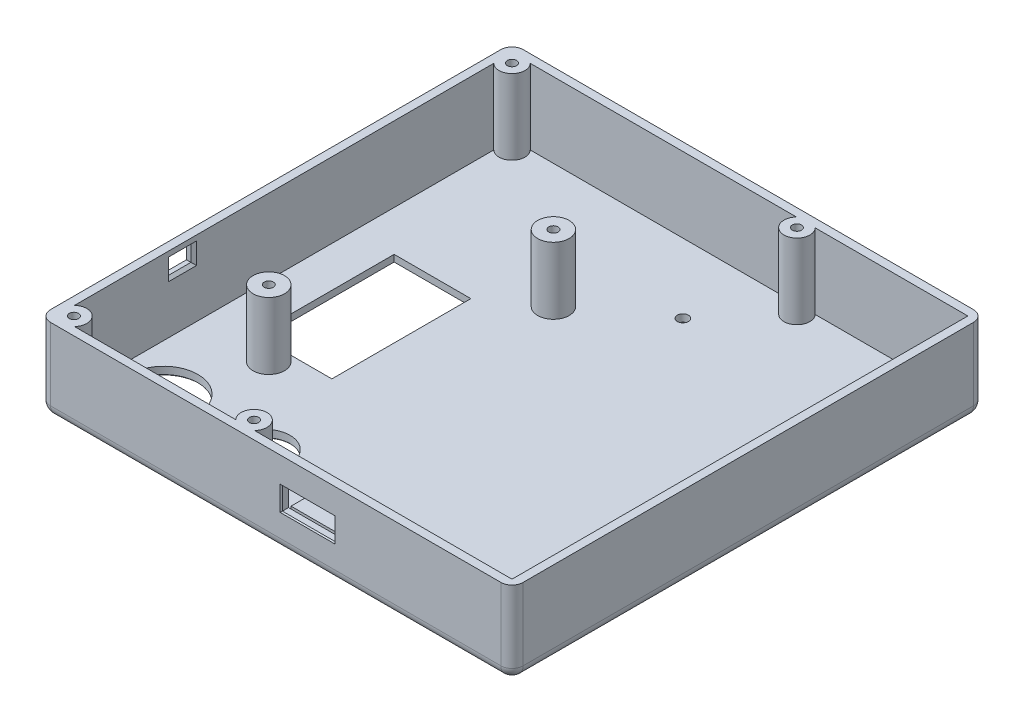
from build123d import *

# Parameters (mm, degrees)
SKETCH_1_W            = 85
SKETCH_1_H            = 85
EXTRUDE_1_DEPTH       = 15
SHELL_1_T             = -1.5
FILLET_1_R            = 2
FILLET_2_R            = 2
CUT_EXTRUDE_7_REACH   = 98.209
SKETCH_16_W           = 9.5
SKETCH_16_H           = 4
CUT_EXTRUDE_2_REACH   = 63.948
SKETCH_3_R            = 1.9
CUT_EXTRUDE_3_REACH   = 63.948
SKETCH_4_R            = 6.15
CHAMFER_1_SIZE        = 0.2
CUT_EXTRUDE_4_REACH   = 98.209
SKETCH_5_W            = 4
SKETCH_5_H            = 2.84
CHAMFER_3_SIZE        = 0.2
CHAMFER_4_SIZE        = 0.5
CUT_EXTRUDE_6_REACH   = 63.948
SKETCH_6_W            = 13.8
SKETCH_6_H            = 25
CHAMFER_6_SIZE        = 0.3
CUT_EXTRUDE_7_2_REACH = 63.948
SKETCH_7_R            = 4.45
CUT_EXTRUDE_8_REACH   = 63.948
SKETCH_9_R            = 1
CHAMFER_7_SIZE        = 0.2
SKETCH_10_R           = 2.325
SKETCH_10_R_2         = 0.825
EXTRUDE_1_2_DEPTH     = 13.5
SKETCH_12_R           = 2.825
SKETCH_12_R_2         = 0.825
EXTRUDE_2_DEPTH       = 12
EXTRUDE_START         = -1.5
SKETCH_14_W           = 5
SKETCH_14_H           = 5
EXTRUDE_3_DEPTH       = 3.9
SKETCH_15_W           = 9
SKETCH_15_H           = 4
EXTRUDE_4_DEPTH       = 5
CUT_EXTRUDE_1_DEPTH   = 0.2


with BuildPart() as part:
    # 草图1 → Extrude 1 (new body)
    with BuildSketch(Plane(origin=(0, 0, 0), x_dir=(1, 0, 0), z_dir=(0, 1, 0))):
        Rectangle(SKETCH_1_W, SKETCH_1_H)
    extrude(amount=EXTRUDE_1_DEPTH)

    # 抽壳1
    shell_1_openings = [part.faces().sort_by_distance(p)[0] for p in [
        (0, 15, 0),
    ]]
    offset(amount=SHELL_1_T, openings=shell_1_openings, kind=Kind.INTERSECTION)

    # 圆角1
    fillet_1_edges = [part.edges().sort_by_distance(p)[0] for p in [
        (0, 0, 42.5),
        (-42.5, 0, 0),
        (0, 0, -42.5),
        (42.5, 0, 0),
    ]]
    fillet(fillet_1_edges, radius=FILLET_1_R)

    # 圆角2
    # the kernel refuses this fillet: 2 mm, written as the material it takes off along each edge
    with BuildSketch(Plane(origin=(-40.5, 2, -40.5), x_dir=(-1, 0, 0), z_dir=(0, 0, -1))) as fillet_2_piece_1_section:
        Polygon((0, 0), (FILLET_2_R, 0), (FILLET_2_R, -FILLET_2_R), (0, -FILLET_2_R), align=None)
    fillet_2_piece_1 = extrude(amount=FILLET_2_R, mode=Mode.PRIVATE)
    fillet_2_piece_1 = fillet_2_piece_1 - Plane(origin=(-40.5, 2, -40.5), x_dir=(0.7071067811865475, 0.7071067811865475, 0), z_dir=(0, 0, -1)) * Sphere(FILLET_2_R, mode=Mode.PRIVATE)
    add(fillet_2_piece_1, mode=Mode.SUBTRACT)
    with BuildSketch(Plane(origin=(40.5, 2, -40.5), x_dir=(1, 0, 0), z_dir=(0, 0, -1))) as fillet_2_piece_2_section:
        Polygon((0, 0), (FILLET_2_R, 0), (FILLET_2_R, FILLET_2_R), (0, FILLET_2_R), align=None)
    fillet_2_piece_2 = extrude(amount=FILLET_2_R, mode=Mode.PRIVATE)
    fillet_2_piece_2 = fillet_2_piece_2 - Plane(origin=(40.5, 2, -40.5), x_dir=(-0.7071067811865475, 0.7071067811865475, 0), z_dir=(0, 0, -1)) * Sphere(FILLET_2_R, mode=Mode.PRIVATE)
    add(fillet_2_piece_2, mode=Mode.SUBTRACT)
    with BuildSketch(Plane(origin=(-40.5, 2, 40.5), x_dir=(0, 0, 1), z_dir=(-1, 0, 0))) as fillet_2_piece_3_section:
        Polygon((0, 0), (FILLET_2_R, 0), (FILLET_2_R, -FILLET_2_R), (0, -FILLET_2_R), align=None)
    fillet_2_piece_3 = extrude(amount=FILLET_2_R, mode=Mode.PRIVATE)
    fillet_2_piece_3 = fillet_2_piece_3 - Plane(origin=(-40.5, 2, 40.5), x_dir=(0, 0.7071067811865475, -0.7071067811865475), z_dir=(-1, 0, 0)) * Sphere(FILLET_2_R, mode=Mode.PRIVATE)
    add(fillet_2_piece_3, mode=Mode.SUBTRACT)
    with BuildSketch(Plane(origin=(40.5, 2, 40.5), x_dir=(0, 0, 1), z_dir=(1, 0, 0))) as fillet_2_piece_4_section:
        Polygon((0, 0), (FILLET_2_R, 0), (FILLET_2_R, FILLET_2_R), (0, FILLET_2_R), align=None)
    fillet_2_piece_4 = extrude(amount=FILLET_2_R, mode=Mode.PRIVATE)
    fillet_2_piece_4 = fillet_2_piece_4 - Plane(origin=(40.5, 2, 40.5), x_dir=(0, 0.7071067811865475, -0.7071067811865475), z_dir=(1, 0, 0)) * Sphere(FILLET_2_R, mode=Mode.PRIVATE)
    add(fillet_2_piece_4, mode=Mode.SUBTRACT)
    with BuildSketch(Plane(origin=(42.5, 2, 42.5), x_dir=(0, 0, -1), z_dir=(0, 1, 0)), Plane(origin=(42.5, 2, -42.5), x_dir=(-1, 0, 0), z_dir=(0, 1, 0))) as fillet_2_piece_5:
        with BuildLine():
            CenterArc((FILLET_2_R, FILLET_2_R), FILLET_2_R, 180, 90)
            Line((0, FILLET_2_R), (0, 0))
            Line((0, 0), (FILLET_2_R, 0))
        make_face()
    extrude(amount=18, mode=Mode.SUBTRACT)
    with BuildSketch(Plane(origin=(-42.5, 2, 42.5), x_dir=(0, 0, -1), z_dir=(0, 1, 0)), Plane(origin=(-42.5, 2, -42.5), x_dir=(1, 0, 0), z_dir=(0, 1, 0))) as fillet_2_piece_6:
        with BuildLine():
            CenterArc((FILLET_2_R, -FILLET_2_R), FILLET_2_R, 90, 90)
            Line((0, -FILLET_2_R), (0, 0))
            Line((0, 0), (FILLET_2_R, 0))
        make_face()
    extrude(amount=18, mode=Mode.SUBTRACT)

    # 草图16 → Cut-Extrude 7 (cut, up to next)
    with BuildSketch(Plane.XY.offset(42.5), mode=Mode.PRIVATE) as cut_extrude_7_sk1:
        with Locations((5.75, 8.25)):
            Rectangle(SKETCH_16_W, SKETCH_16_H)
    cut_extrude_7_tool1 = extrude(cut_extrude_7_sk1.sketch, amount=-CUT_EXTRUDE_7_REACH, mode=Mode.PRIVATE) & part.part
    add(cut_extrude_7_tool1.solids().sort_by_distance((5.75, 8.25, 42.5))[0], mode=Mode.SUBTRACT)

    # 草图3 → 充电灯切除-拉伸2 (cut, up to next)
    with BuildSketch(Plane.XZ, mode=Mode.PRIVATE) as cut_extrude_2_sk1:
        with Locations(Location((13.002314109, 32.5, 0), (0, 0, 270))):
            Circle(SKETCH_3_R)
    cut_extrude_2_tool1 = extrude(cut_extrude_2_sk1.sketch, amount=-CUT_EXTRUDE_2_REACH, mode=Mode.PRIVATE) & part.part
    add(cut_extrude_2_tool1.solids().sort_by_distance((13.002314, 0, 32.5))[0], mode=Mode.SUBTRACT)

    # 草图4 → 按钮切除-拉伸3 (cut, up to next)
    with BuildSketch(Plane.XZ, mode=Mode.PRIVATE) as cut_extrude_3_sk1:
        with Locations(Location((-32.65, 30, 0), (0, 0, 270))):
            Circle(SKETCH_4_R)
    cut_extrude_3_tool1 = extrude(cut_extrude_3_sk1.sketch, amount=-CUT_EXTRUDE_3_REACH, mode=Mode.PRIVATE) & part.part
    add(cut_extrude_3_tool1.solids().sort_by_distance((-32.65, 0, 30))[0], mode=Mode.SUBTRACT)

    # 充电口灯倒角1
    chamfer_1_edges = [part.edges().sort_by_distance(p)[0] for p in [
        (1, 8.25, 42.5),
        (5.75, 6.25, 42.5),
        (10.5, 8.25, 42.5),
        (5.75, 10.25, 42.5),
        (5.75, 6.25, 41),
        (10.5, 8.25, 41),
        (5.75, 10.25, 41),
        (1, 8.25, 41),
        (13.002314109, 1.5, 34.4),
    ]]
    chamfer(chamfer_1_edges, length=CHAMFER_1_SIZE)

    # 草图5 → 开关切除-拉伸4 (cut, up to next)
    with BuildSketch(Plane.ZY.offset(42.5), mode=Mode.PRIVATE) as cut_extrude_4_sk1:
        with Locations((18.25, 12.15)):
            Rectangle(SKETCH_5_W, SKETCH_5_H)
    cut_extrude_4_tool1 = extrude(cut_extrude_4_sk1.sketch, amount=-CUT_EXTRUDE_4_REACH, mode=Mode.PRIVATE) & part.part
    add(cut_extrude_4_tool1.solids().sort_by_distance((-42.5, 12.15, 18.25))[0], mode=Mode.SUBTRACT)

    # 开关倒角3
    chamfer_3_edges = [part.edges().sort_by_distance(p)[0] for p in [
        (-42.5, 12.15, 16.25),
        (-42.5, 10.73, 18.25),
        (-42.5, 12.15, 20.25),
        (-42.5, 13.57, 18.25),
    ]]
    chamfer(chamfer_3_edges, length=CHAMFER_3_SIZE)

    # 开关倒角4
    chamfer_4_edges = [part.edges().sort_by_distance(p)[0] for p in [
        (-41, 10.73, 18.25),
        (-41, 12.15, 20.25),
        (-41, 13.57, 18.25),
        (-41, 12.15, 16.25),
    ]]
    chamfer(chamfer_4_edges, length=CHAMFER_4_SIZE)

    # 草图6 → 屏幕切除-拉伸6 (cut, up to next)
    with BuildSketch(Plane.XZ, mode=Mode.PRIVATE) as cut_extrude_6_sk1:
        with Locations((-26.8, 0)):
            Rectangle(SKETCH_6_W, SKETCH_6_H)
    cut_extrude_6_tool1 = extrude(cut_extrude_6_sk1.sketch, amount=-CUT_EXTRUDE_6_REACH, mode=Mode.PRIVATE) & part.part
    add(cut_extrude_6_tool1.solids().sort_by_distance((-26.8, 0, 0))[0], mode=Mode.SUBTRACT)

    # 屏幕倒角6
    chamfer_6_edges = [part.edges().sort_by_distance(p)[0] for p in [
        (-19.9, 0, 0),
        (-26.8, 0, 12.5),
        (-33.7, 0, 0),
        (-26.8, 0, -12.5),
    ]]
    chamfer(chamfer_6_edges, length=CHAMFER_6_SIZE)

    # 草图7 → Cut-Extrude 7 2 (cut, up to next)
    with BuildSketch(Plane.XZ, mode=Mode.PRIVATE) as cut_extrude_7_2_sk1:
        with Locations(Location((-14.877357519, 29.5, 0), (0, 0, 270))):
            Circle(SKETCH_7_R)
    cut_extrude_7_2_tool1 = extrude(cut_extrude_7_2_sk1.sketch, amount=-CUT_EXTRUDE_7_2_REACH, mode=Mode.PRIVATE) & part.part
    add(cut_extrude_7_2_tool1.solids().sort_by_distance((-14.877358, 0, 29.5))[0], mode=Mode.SUBTRACT)

    # 草图9 → 蜂鸣切除-拉伸8 (cut, up to next)
    with BuildSketch(Plane.XZ, mode=Mode.PRIVATE) as cut_extrude_8_sk1:
        with Locations(Location((2.238237088, -28.5, 0), (0, 0, 270))):
            Circle(SKETCH_9_R)
    cut_extrude_8_tool1 = extrude(cut_extrude_8_sk1.sketch, amount=-CUT_EXTRUDE_8_REACH, mode=Mode.PRIVATE) & part.part
    add(cut_extrude_8_tool1.solids().sort_by_distance((2.238237, 0, -28.5))[0], mode=Mode.SUBTRACT)

    # 蜂鸣倒角7
    chamfer_7_edges = [part.edges().sort_by_distance(p)[0] for p in [
        (-14.877357519, 0, 33.95),
        (2.238237088, 0, -27.5),
        (-32.65, 0, 36.15),
    ]]
    chamfer(chamfer_7_edges, length=CHAMFER_7_SIZE)

    # 草图10 → Extrude 1 2 (add)
    # profile 1 of 4: a face of its own
    with BuildSketch(Plane(origin=(0, 1.5, 0), x_dir=(1, 0, 0), z_dir=(0, 1, 0))):
        with Locations((-39.4, 39.4)):
            Circle(SKETCH_10_R)
        with Locations((-39.4, 39.4)):
            Circle(SKETCH_10_R_2, mode=Mode.SUBTRACT)
    # profile 2 of 4: a face of its own
    with BuildSketch(Plane(origin=(0, 1.5, 0), x_dir=(1, 0, 0), z_dir=(0, 1, 0))):
        with Locations((-39.4, -39.4)):
            Circle(SKETCH_10_R)
        with Locations((-39.4, -39.4)):
            Circle(SKETCH_10_R_2, mode=Mode.SUBTRACT)
    # profile 3 of 4: a face of its own
    with BuildSketch(Plane(origin=(0, 1.5, 0), x_dir=(1, 0, 0), z_dir=(0, 1, 0))):
        with Locations((-7, -39.4)):
            Circle(SKETCH_10_R)
        with Locations((-7, -39.4)):
            Circle(SKETCH_10_R_2, mode=Mode.SUBTRACT)
    # profile 4 of 4: a face of its own
    with BuildSketch(Plane(origin=(0, 1.5, 0), x_dir=(1, 0, 0), z_dir=(0, 1, 0))):
        with Locations((11.85, 39.4)):
            Circle(SKETCH_10_R)
        with Locations((11.85, 39.4)):
            Circle(SKETCH_10_R_2, mode=Mode.SUBTRACT)
    extrude(amount=EXTRUDE_1_2_DEPTH)

    # 草图12 → 压板固定凸台-拉伸2 (add)
    # profile 1 of 2: a face of its own
    with BuildSketch(Plane(origin=(0, 1.5, 0), x_dir=(1, 0, 0), z_dir=(0, 1, 0))):
        with Locations(Location((-28.25, -15.5, 0), (0, 0, 90))):
            Circle(SKETCH_12_R)
        with Locations(Location((-28.25, -15.5, 0), (0, 0, 90))):
            Circle(SKETCH_12_R_2, mode=Mode.SUBTRACT)
    # profile 2 of 2: a face of its own
    with BuildSketch(Plane(origin=(0, 1.5, 0), x_dir=(1, 0, 0), z_dir=(0, 1, 0))):
        with Locations(Location((-11.25, 18.7, 0), (0, 0, 90))):
            Circle(SKETCH_12_R)
        with Locations(Location((-11.25, 18.7, 0), (0, 0, 90))):
            Circle(SKETCH_12_R_2, mode=Mode.SUBTRACT)
    extrude(amount=EXTRUDE_2_DEPTH)

    # 草图14 → 电池顶凸台-拉伸3 (add)
    with BuildSketch(Plane(origin=(42.5, 0, 0), x_dir=(0, 0, -1), z_dir=(1, 0, 0)).offset(EXTRUDE_START)):
        with Locations((12.5, 2.5)):
            Rectangle(SKETCH_14_W, SKETCH_14_H)
        with Locations((-12.5, 2.5)):
            Rectangle(SKETCH_14_W, SKETCH_14_H)
    extrude(amount=-EXTRUDE_3_DEPTH)

    # 草图15 → 充电板凸台-拉伸4 (add)
    with BuildSketch(Plane(origin=(0, 1.5, 0), x_dir=(1, 0, 0), z_dir=(0, 1, 0))):
        with Locations((5.75, -39)):
            Rectangle(SKETCH_15_W, SKETCH_15_H)
    extrude(amount=EXTRUDE_4_DEPTH)

    # 草图17 → 名字切除-拉伸1 (cut)
    with BuildSketch(Plane(origin=(0, 0, 0), x_dir=(-1, 0, 0), z_dir=(0, -1, 0))):
        Polygon((-40.355967078, 2.134502924), (-40.355967078, 3.001949318), (-38.060103964, 3.001949318), (-38.060103964, 4.430366039), (-40.355967078, 4.430366039), (-40.355967078, 5.297812432), (-35.310482998, 5.297812432), (-35.310482998, 4.430366039), (-37.376759801, 4.430366039), (-37.376759801, 3.001949318), (-35.310482998, 3.001949318), (-35.310482998, 2.134502924), align=None)
        with BuildLine():
            Line((-40.413363656, -1.67749621), (-40.413363656, -0.995235001))
            Line((-40.413363656, -0.995235001), (-40.011587611, -0.945419103))
            add(Edge.make_bspline(
                [(-40.011587611, -0.945419103), (-40.023173991, -0.946455063), (-40.046697511, -0.948558344), (-40.082350348, -0.938918885), (-40.11682405, -0.919528378), (-40.150153985, -0.890191347), (-40.185160711, -0.853552088), (-40.218568564, -0.806295354), (-40.250280714, -0.749316188), (-40.295670626, -0.663101134), (-40.342564465, -0.543837605), (-40.38384881, -0.393567802), (-40.408081197, -0.236500738), (-40.411580957, -0.130037023), (-40.413363656, -0.075806801)],
                knots=[0, 0, 0, 0, 0.404696217, 0.821643991, 1.2685562, 1.779992503, 2.370187412, 3.040257717, 3.799114121, 4.65279833, 6.450830066, 8.272346861, 10.101217337, 12, 12, 12, 12], degree=3))
            add(Edge.make_bspline(
                [(-40.413363656, -0.075806801), (-40.41199032, -0.023307022), (-40.409270379, 0.080670632), (-40.378514182, 0.233580696), (-40.335610916, 0.383063478), (-40.269878784, 0.526565484), (-40.188533223, 0.666640783), (-40.086902643, 0.800277289), (-39.968481008, 0.930394843), (-39.833123507, 1.056065498), (-39.676361403, 1.171289597), (-39.498645708, 1.272675728), (-39.298692575, 1.356482913), (-39.077963034, 1.425926951), (-38.835553075, 1.477541915), (-38.572699267, 1.516821699), (-38.288632061, 1.539100214), (-38.092269709, 1.541809691), (-37.990794888, 1.543209877)],
                knots=[0, 0, 0, 0, 0.773044084, 1.531040948, 2.292283268, 3.061947587, 3.851673562, 4.676776182, 5.532229731, 6.443919552, 7.395753455, 8.394737639, 9.453688371, 10.58673905, 11.802141563, 13.104542272, 14.503704746, 16, 16, 16, 16], degree=3))
            add(Edge.make_bspline(
                [(-37.990794888, 1.543209877), (-37.880291425, 1.542250849), (-37.665914443, 1.540390334), (-37.355495126, 1.517914892), (-37.066148738, 1.484170336), (-36.798316237, 1.435956581), (-36.551371696, 1.373354476), (-36.325608556, 1.297329572), (-36.12136558, 1.206039209), (-35.938687419, 1.101245775), (-35.777886869, 0.983455531), (-35.635949629, 0.857198141), (-35.518673669, 0.716908122), (-35.420924366, 0.567937102), (-35.345425303, 0.407484714), (-35.291029955, 0.236862237), (-35.259278799, 0.054964389), (-35.255181324, -0.069545543), (-35.25308642, -0.133203379)],
                knots=[0, 0, 0, 0, 1.47273082, 2.857101309, 4.146301039, 5.354409463, 6.481806689, 7.539389837, 8.52583362, 9.459309067, 10.340928617, 11.178949196, 11.984827434, 12.77095453, 13.548001538, 14.340859511, 15.151736002, 16, 16, 16, 16], degree=3))
            add(Edge.make_bspline(
                [(-35.25308642, -0.133203379), (-35.254863467, -0.193559328), (-35.258325543, -0.311145842), (-35.281993933, -0.482697225), (-35.323343904, -0.643031973), (-35.379404419, -0.793365985), (-35.45380347, -0.931815792), (-35.54473621, -1.059522599), (-35.651051358, -1.177227384), (-35.77418971, -1.281835952), (-35.909903427, -1.374825348), (-36.056069833, -1.455975637), (-36.212409693, -1.524521236), (-36.378600967, -1.58112457), (-36.555632393, -1.623745063), (-36.742296129, -1.655307952), (-36.938879097, -1.673653876), (-37.073133623, -1.67619652), (-37.141758718, -1.67749621)],
                knots=[0, 0, 0, 0, 1.050897452, 2.047376777, 3.007818391, 3.928888077, 4.834384147, 5.73605433, 6.652716803, 7.588784625, 8.5424768, 9.513188621, 10.49539143, 11.511112616, 12.566062531, 13.662443328, 14.805142358, 16, 16, 16, 16], degree=3))
            Line((-37.141758718, -1.67749621), (-37.141758718, -0.838206628))
            add(Edge.make_bspline(
                [(-37.141758718, -0.838206628), (-37.089763307, -0.837551724), (-36.989307643, -0.836286444), (-36.8444216, -0.827534939), (-36.710574983, -0.814033888), (-36.588664528, -0.793705361), (-36.478336838, -0.767607976), (-36.379305607, -0.737049823), (-36.292067853, -0.698752127), (-36.215404082, -0.655737208), (-36.149837959, -0.606180334), (-36.092671224, -0.552575276), (-36.043653678, -0.494424074), (-36.004388814, -0.430741438), (-35.973753834, -0.363048682), (-35.951986456, -0.290612939), (-35.938797232, -0.213463863), (-35.93723047, -0.160330046), (-35.936430583, -0.133203379)],
                knots=[0, 0, 0, 0, 1.586117427, 3.064395076, 4.426454156, 5.688313594, 6.831527658, 7.883304614, 8.844913662, 9.732754864, 10.558678473, 11.345500466, 12.119580818, 12.871327597, 13.620488824, 14.379939443, 15.172902578, 16, 16, 16, 16], degree=3))
            add(Edge.make_bspline(
                [(-35.936430583, -0.133203379), (-35.937521574, -0.104189252), (-35.939664724, -0.047193701), (-35.961544855, 0.035947211), (-35.996310528, 0.114177294), (-36.045272213, 0.188490225), (-36.108480405, 0.256950976), (-36.184502509, 0.32215017), (-36.275058647, 0.380750902), (-36.379177619, 0.437054943), (-36.501281835, 0.487237861), (-36.643620095, 0.529634257), (-36.806859098, 0.566058126), (-36.991234931, 0.596277878), (-37.197049805, 0.617713082), (-37.423777925, 0.635598316), (-37.671609577, 0.644709613), (-37.84386827, 0.645903305), (-37.933398311, 0.646523717)],
                knots=[0, 0, 0, 0, 0.593631818, 1.166134478, 1.749156563, 2.342280865, 2.981395212, 3.653172718, 4.389945561, 5.187801188, 6.076895088, 7.09042634, 8.228524728, 9.503407828, 10.917896152, 12.46894099, 14.164761097, 16, 16, 16, 16], degree=3))
            add(Edge.make_bspline(
                [(-37.933398311, 0.646523717), (-38.01824423, 0.645672375), (-38.180444893, 0.644044857), (-38.413144493, 0.632377422), (-38.624306761, 0.612492511), (-38.814111119, 0.583377968), (-38.982724816, 0.547502818), (-39.129815764, 0.502539506), (-39.255576987, 0.449075241), (-39.360120313, 0.386234961), (-39.446659758, 0.318884062), (-39.522467924, 0.253188071), (-39.585704633, 0.185487857), (-39.638171654, 0.117618325), (-39.678649473, 0.048706528), (-39.708770526, -0.020089322), (-39.727078184, -0.090378026), (-39.72904294, -0.137793178), (-39.730019493, -0.161360191)],
                knots=[0, 0, 0, 0, 1.891494353, 3.615985765, 5.192728043, 6.617747388, 7.894805822, 9.032616008, 10.041798274, 10.933392695, 11.743021583, 12.484201115, 13.167454311, 13.804854117, 14.39283549, 14.944443786, 15.475351122, 16, 16, 16, 16], degree=3))
            add(Edge.make_bspline(
                [(-39.730019493, -0.161360191), (-39.729007779, -0.188822401), (-39.727016568, -0.242872334), (-39.716708599, -0.321837463), (-39.697152429, -0.396500927), (-39.668347661, -0.465772535), (-39.633901459, -0.531798357), (-39.590351436, -0.592493535), (-39.538358065, -0.648037774), (-39.480016796, -0.700541959), (-39.412220503, -0.747504556), (-39.334597784, -0.787495469), (-39.247703164, -0.820798321), (-39.151844347, -0.847484729), (-39.046924833, -0.869112659), (-38.932697359, -0.885519396), (-38.808900831, -0.89349202), (-38.723602725, -0.894884245), (-38.679553823, -0.895603206)],
                knots=[0, 0, 0, 0, 0.907460155, 1.786023762, 2.624765265, 3.44845472, 4.259270517, 5.07984713, 5.90680965, 6.768296276, 7.667967605, 8.622613486, 9.645627769, 10.736440185, 11.905698631, 13.182209581, 14.544861327, 16, 16, 16, 16], degree=3))
            Line((-38.679553823, -0.895603206), (-38.433723197, -0.895603206))
            Line((-38.433723197, -0.895603206), (-38.433723197, -0.006497726))
            Line((-38.433723197, -0.006497726), (-37.74929608, -0.006497726))
            Line((-37.74929608, -0.006497726), (-37.74929608, -1.67749621))
            Line((-37.74929608, -1.67749621), (-40.413363656, -1.67749621))
        make_face()
        Polygon((-40.355967078, -5.489495343), (-40.355967078, -4.62204895), (-38.060103964, -4.62204895), (-38.060103964, -3.193632229), (-40.355967078, -3.193632229), (-40.355967078, -2.326185835), (-35.310482998, -2.326185835), (-35.310482998, -3.193632229), (-37.376759801, -3.193632229), (-37.376759801, -4.62204895), (-35.310482998, -4.62204895), (-35.310482998, -5.489495343), align=None)
    extrude(amount=-CUT_EXTRUDE_1_DEPTH, mode=Mode.SUBTRACT)


solid = part.part
